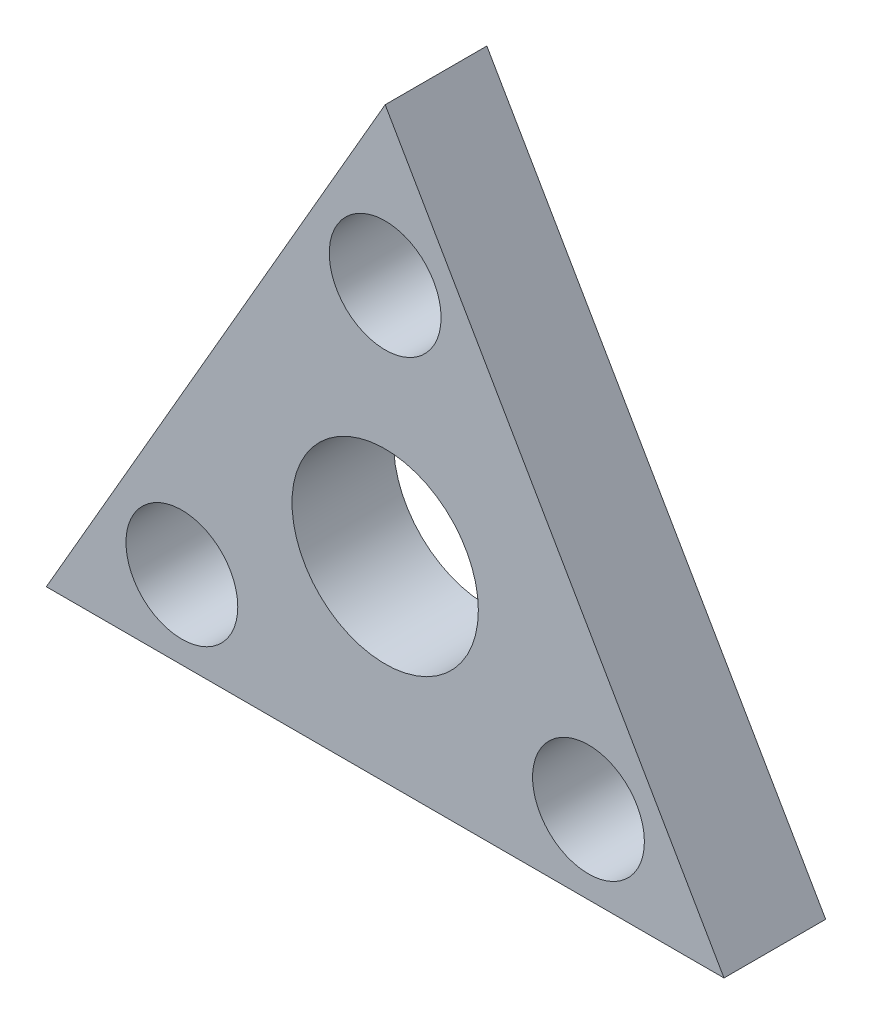
from build123d import *

# Parameters (mm, degrees)
SKETCH_1_R      = 1.65
SKETCH_1_R_2    = 2.75
EXTRUDE_1_DEPTH = 3


with BuildPart() as part:
    # 草图1 → 凸台-拉伸1 (new body)
    with BuildSketch(Plane.XY):
        Polygon((0, 11.547005384), (-10, -5.773502692), (10, -5.773502692), align=None)
        with Locations((0, 6.92820323)):
            Circle(SKETCH_1_R, mode=Mode.SUBTRACT)
        with Locations((-6, -3.464101615)):
            Circle(SKETCH_1_R, mode=Mode.SUBTRACT)
        with Locations((6, -3.464101615)):
            Circle(SKETCH_1_R, mode=Mode.SUBTRACT)
        Circle(SKETCH_1_R_2, mode=Mode.SUBTRACT)
    extrude(amount=EXTRUDE_1_DEPTH)


solid = part.part
